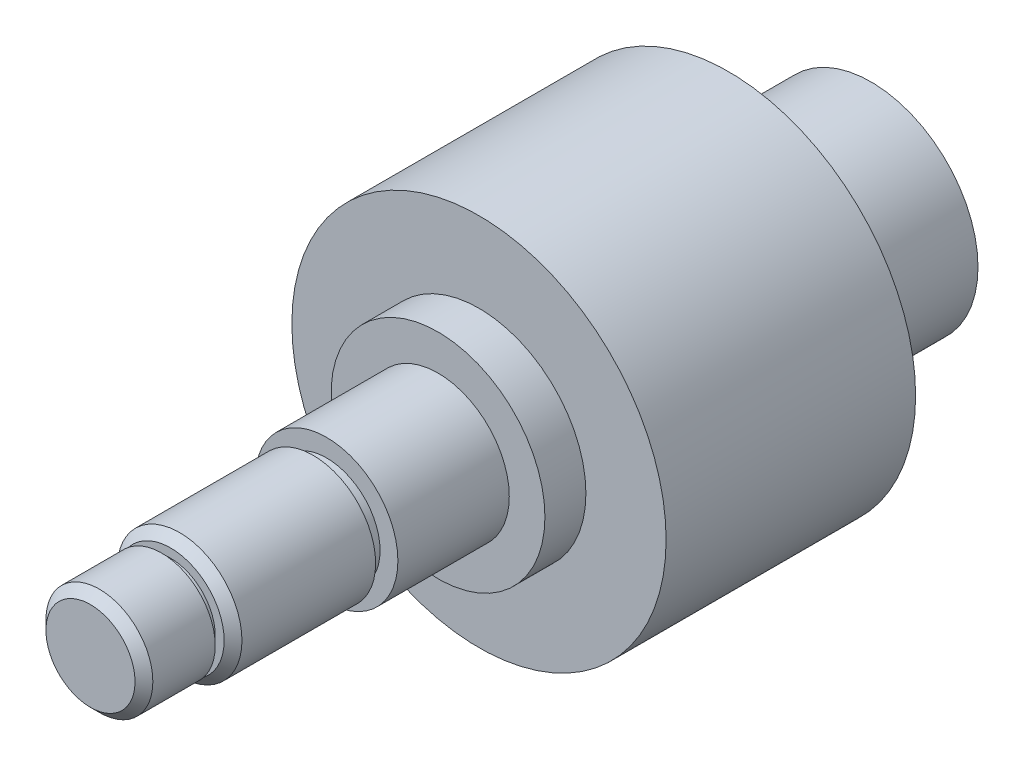
from build123d import *

# Parameters (mm, degrees)
ESQUISSE1_R             = 6
BOSS_EXTRU_1_DEPTH      = 8
ESQUISSE2_R             = 10.5
BOSS_EXTRU_2_DEPTH      = 14
ESQUISSE3_R             = 6
BOSS_EXTRU_3_DEPTH      = 2.3
ESQUISSE4_R             = 4
BOSS_EXTRU_4_DEPTH      = 6.25
ESQUISSE5_R             = 3
BOSS_EXTRU_5_DEPTH      = 0.75
ESQUISSE7_R             = 3.5
BOSS_EXTRU_6_DEPTH      = 8
ESQUISSE8_R             = 2.5
BOSS_EXTRU_7_DEPTH      = 0.5
ESQUISSE9_R             = 3
BOSS_EXTRU_8_DEPTH      = 4
ESQUISSE10_R            = 4.75
ENL_V_MAT_EXTRU_1_DEPTH = 21
CHANFREIN1_SIZE         = 0.5
CHANFREIN2_SIZE         = 0.5


with BuildPart() as part:
    # Esquisse1 → Boss.-Extru.1 (new body)
    with BuildSketch(Plane.XY):
        Circle(ESQUISSE1_R)
    extrude(amount=BOSS_EXTRU_1_DEPTH)

    # Esquisse2 → Boss.-Extru.2 (add)
    with BuildSketch(Plane.XY.offset(8)):
        Circle(ESQUISSE2_R)
    extrude(amount=BOSS_EXTRU_2_DEPTH)

    # Esquisse3 → Boss.-Extru.3 (add)
    with BuildSketch(Plane.XY.offset(22)):
        Circle(ESQUISSE3_R)
    extrude(amount=BOSS_EXTRU_3_DEPTH)

    # Esquisse4 → Boss.-Extru.4 (add)
    with BuildSketch(Plane.XY.offset(24.3)):
        Circle(ESQUISSE4_R)
    extrude(amount=BOSS_EXTRU_4_DEPTH)

    # Esquisse5 → Boss.-Extru.5 (add)
    with BuildSketch(Plane.XY.offset(30.55)):
        Circle(ESQUISSE5_R)
    extrude(amount=BOSS_EXTRU_5_DEPTH)

    # Esquisse7 → Boss.-Extru.6 (add)
    with BuildSketch(Plane.XY.offset(31.3)):
        Circle(ESQUISSE7_R)
    extrude(amount=BOSS_EXTRU_6_DEPTH)

    # Esquisse8 → Boss.-Extru.7 (add)
    with BuildSketch(Plane.XY.offset(39.3)):
        Circle(ESQUISSE8_R)
    extrude(amount=BOSS_EXTRU_7_DEPTH)

    # Esquisse9 → Boss.-Extru.8 (add)
    with BuildSketch(Plane.XY.offset(39.8)):
        Circle(ESQUISSE9_R)
    extrude(amount=BOSS_EXTRU_8_DEPTH)

    # Esquisse10 → Enlèv. mat.-Extru.1 (cut)
    with BuildSketch(Plane(origin=(0, 0, 0), x_dir=(-1, 0, 0), z_dir=(0, 0, -1))):
        Circle(ESQUISSE10_R)
    extrude(amount=-ENL_V_MAT_EXTRU_1_DEPTH, mode=Mode.SUBTRACT)

    # Chanfrein1
    chanfrein1_edges = [part.edges().sort_by_distance(p)[0] for p in [
        (-3.5, 0, 39.3),
    ]]
    chamfer(chanfrein1_edges, length=CHANFREIN1_SIZE)

    # Chanfrein2
    chanfrein2_edges = [part.edges().sort_by_distance(p)[0] for p in [
        (-3, 0, 43.8),
    ]]
    chamfer(chanfrein2_edges, length=CHANFREIN2_SIZE)


solid = part.part
